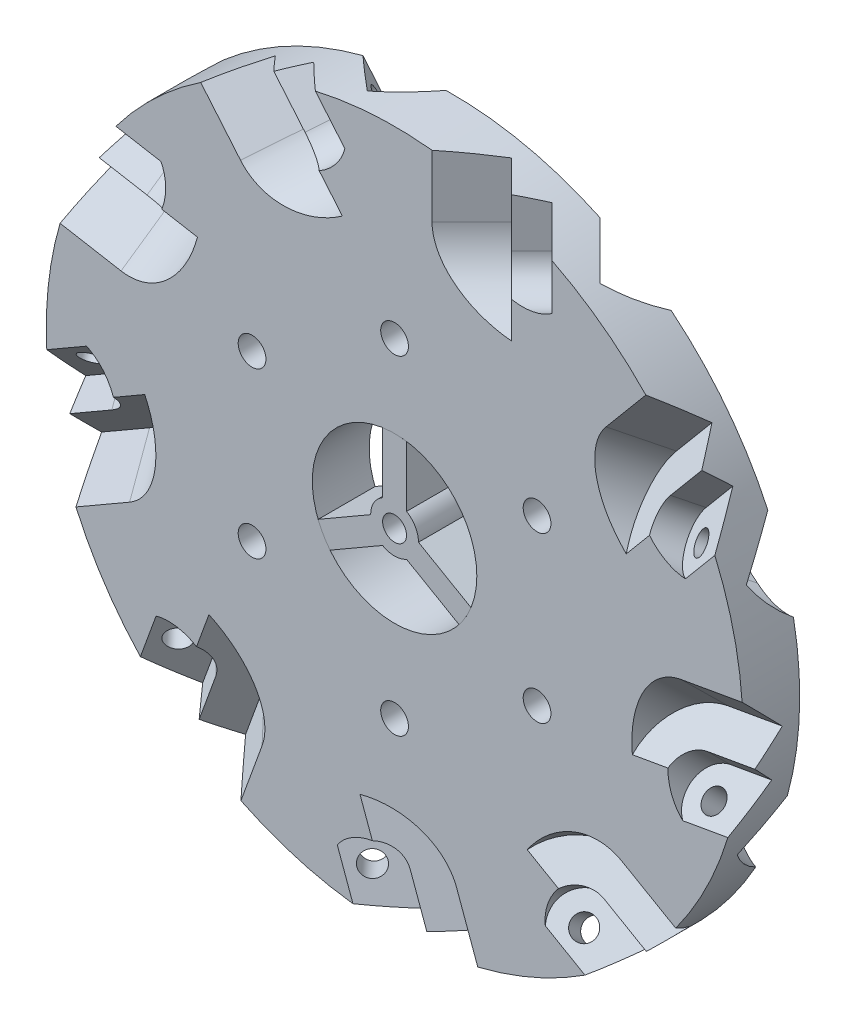
from build123d import *

# Parameters (mm, degrees)
SKETCH_1_R               = 122.5
EXTRUDE_1_DEPTH          = 20
SKETCH_2_R               = 28.935
CUT_EXTRUDE_1_DEPTH      = 175.391800266
SKETCH_3_R               = 4.878
CUT_EXTRUDE_3_DEPTH      = 175.391800266
SKETCH_8_R               = 4
CUT_EXTRUDE_7_DEPTH      = 175.391800266
SKETCH_9_R               = 22.5
CUT_EXTRUDE_8_DEPTH      = 15
SKETCH_10_W              = 22.5
SKETCH_10_H              = 46.497744754
CUT_EXTRUDE_9_DEPTH      = 184.46765804
CUT_EXTRUDE_10_DEPTH     = 10
CUT_EXTRUDE_START        = -12
CUT_EXTRUDE_11_DEPTH     = 178.935873063
PATTERN_CIRCULAR_4_COUNT = 9
SCALE_1_SCALE            = 0.41
SCALE_2_SCALE            = 0.58
EXTRUDE_START            = -4.756
EXTRUDE_2_OUTLINE_R      = 1
EXTRUDE_2_DEPTH          = 4.756


# Read off the part's stored shape, not the designer's step: 凸台-拉伸2
with BuildPart() as part:
    # 草图1 → 凸台-拉伸1 (new body)
    with BuildSketch(Plane.XY):
        Circle(SKETCH_1_R)
    extrude(amount=EXTRUDE_1_DEPTH)

    # 草图2 → 切除-拉伸1 (cut, through all)
    with BuildSketch(Plane.XY.offset(20)):
        Circle(SKETCH_2_R)
    extrude(amount=-CUT_EXTRUDE_1_DEPTH, mode=Mode.SUBTRACT)

    # 草图3 → 切除-拉伸3 (cut, through all)
    with BuildSketch(Plane.XY.offset(20)):
        with Locations((0, 57.8745)):
            Circle(SKETCH_3_R)
        with Locations((50.120787231, 28.93725)):
            Circle(SKETCH_3_R)
        with Locations((50.120787231, -28.93725)):
            Circle(SKETCH_3_R)
        with Locations((0, -57.8745)):
            Circle(SKETCH_3_R)
        with Locations((-50.120787231, -28.93725)):
            Circle(SKETCH_3_R)
        with Locations((-50.120787231, 28.93725)):
            Circle(SKETCH_3_R)
    extrude(amount=-CUT_EXTRUDE_3_DEPTH, mode=Mode.SUBTRACT)

    # 草图8 → 切除-拉伸7 (cut, through all)
    with BuildSketch(Plane(origin=(0, 0, 0), x_dir=(-0.7071067811865477, 0, -0.7071067811865475), z_dir=(0.7071067811865475, 0, -0.7071067811865477))):
        with Locations(Location((-45.961940777, 100, 0), (0, 0, 178.998987413))):
            Circle(SKETCH_8_R)
    cut_extrude_7 = extrude(amount=CUT_EXTRUDE_7_DEPTH, mode=Mode.SUBTRACT)

    # 草图9 → 切除-拉伸8 (cut, symmetric)
    with BuildSketch(Plane(origin=(0, 0, 0), x_dir=(-0.7071067811865477, 0, -0.7071067811865475), z_dir=(0.7071067811865475, 0, -0.7071067811865477))):
        with Locations((-45.961940777, 100)):
            Circle(SKETCH_9_R)
    cut_extrude_8 = extrude(amount=CUT_EXTRUDE_8_DEPTH, both=True, mode=Mode.SUBTRACT)

    # 草图10 → 切除-拉伸9 (cut, through all)
    with BuildSketch(Plane(origin=(10.606601718, 0, -10.606601718), x_dir=(0.7071067811865476, 0, 0.7071067811865476), z_dir=(-0.7071067811865476, 0, 0.7071067811865476))):
        with Locations((34.711940777, 123.248872377)):
            Rectangle(SKETCH_10_W, SKETCH_10_H)
    cut_extrude_9 = extrude(amount=CUT_EXTRUDE_9_DEPTH, mode=Mode.SUBTRACT)

    # 草图11 → 切除-拉伸10 (cut)
    with BuildSketch(Plane(origin=(10.606601718, 0, -10.606601718), x_dir=(0.7071067811865476, 0, 0.7071067811865476), z_dir=(-0.7071067811865476, 0, 0.7071067811865476))):
        with BuildLine():
            Line((35.961940777, 100), (35.961940777, 125.139929094))
            Line((35.961940777, 125.139929094), (55.961940777, 125.139929094))
            Line((55.961940777, 125.139929094), (55.961940777, 100))
            ThreePointArc((55.961940777, 100), (45.961940777, 90), (35.961940777, 100))
        make_face()
    cut_extrude_10 = extrude(amount=-CUT_EXTRUDE_10_DEPTH, mode=Mode.SUBTRACT)

    # 草图12 → 切除-拉伸11 (cut, through all)
    with BuildSketch(Plane(origin=(17.67766953, 0, -17.67766953), x_dir=(0.7071067811865475, 0, 0.7071067811865477), z_dir=(-0.7071067811865477, 0, 0.7071067811865475)).offset(CUT_EXTRUDE_START)):
        with BuildLine():
            Line((45.961940777, 90), (9.034247942, 90))
            Line((9.034247942, 90), (9.034247942, 129.457708736))
            Line((9.034247942, 129.457708736), (45.961940777, 129.457708736))
            Line((45.961940777, 129.457708736), (45.961940777, 110))
            ThreePointArc((45.961940777, 110), (55.961940777, 100), (45.961940777, 90))
        make_face()
    cut_extrude_11 = extrude(amount=-CUT_EXTRUDE_11_DEPTH, mode=Mode.SUBTRACT)

    # 阵列(圆周)4: 切除-拉伸7, 切除-拉伸8, 切除-拉伸9, 切除-拉伸10, 切除-拉伸11 ×9 about axis
    pattern_circular_4_axis = Axis((0, 0, 0), (0, 0, 1))
    add([cut_extrude_7.rotate(pattern_circular_4_axis, i * 360 / PATTERN_CIRCULAR_4_COUNT) for i in range(1, PATTERN_CIRCULAR_4_COUNT)], mode=Mode.SUBTRACT)
    add([cut_extrude_8.rotate(pattern_circular_4_axis, i * 360 / PATTERN_CIRCULAR_4_COUNT) for i in range(1, PATTERN_CIRCULAR_4_COUNT)], mode=Mode.SUBTRACT)
    add([cut_extrude_9.rotate(pattern_circular_4_axis, i * 360 / PATTERN_CIRCULAR_4_COUNT) for i in range(1, PATTERN_CIRCULAR_4_COUNT)], mode=Mode.SUBTRACT)
    add([cut_extrude_10.rotate(pattern_circular_4_axis, i * 360 / PATTERN_CIRCULAR_4_COUNT) for i in range(1, PATTERN_CIRCULAR_4_COUNT)], mode=Mode.SUBTRACT)
    add([cut_extrude_11.rotate(pattern_circular_4_axis, i * 360 / PATTERN_CIRCULAR_4_COUNT) for i in range(1, PATTERN_CIRCULAR_4_COUNT)], mode=Mode.SUBTRACT)


with BuildPart() as part_1:
    # 缩放比例1: scaled about (1.4211e-05, 4.647e-06, 9.529762595)
    add(part.part.scale(SCALE_1_SCALE).moved(Location((8.384e-06, 2.742e-06, 5.622559931))))


with BuildPart() as part_2:
    # 缩放比例2: scaled about (1.4211e-05, 4.647e-06, 9.529762595)
    add(part_1.part.scale(SCALE_2_SCALE).moved(Location((5.969e-06, 1.952e-06, 4.00250029))))


with BuildPart() as body_2:
    # 凸台-拉伸2 outline → 凸台-拉伸2 (new body)
    with BuildSketch(Plane.XY.offset(12.01956779).offset(EXTRUDE_START)):
        with BuildLine():
            Line((-2, 0), (-6.395631279, -2.537818902))
            ThreePointArc((-6.395631279, -2.537818902), (-5.958898235, -3.4403715), (-5.395631279, -4.26986971))
            Line((-5.395631279, -4.26986971), (-1, -1.732050808))
            ThreePointArc((-1, -1.732050808), (0, -2), (1, -1.732050808))
            Line((1, -1.732050808), (5.395631279, -4.26986971))
            ThreePointArc((5.395631279, -4.26986971), (5.958898235, -3.4403715), (6.395631279, -2.537818902))
            Line((6.395631279, -2.537818902), (2, 0))
            ThreePointArc((2, 0), (1.732050808, 1), (1, 1.732050808))
            Line((1, 1.732050808), (1, 6.807688612))
            ThreePointArc((1, 6.807688612), (0, 6.880743), (-1, 6.807688612))
            Line((-1, 6.807688612), (-1, 1.732050808))
            ThreePointArc((-1, 1.732050808), (-1.732050808, 1), (-2, 0))
        make_face()
        Circle(EXTRUDE_2_OUTLINE_R, mode=Mode.SUBTRACT)
    extrude(amount=EXTRUDE_2_DEPTH)


solid = Compound([part_2.part, body_2.part])
